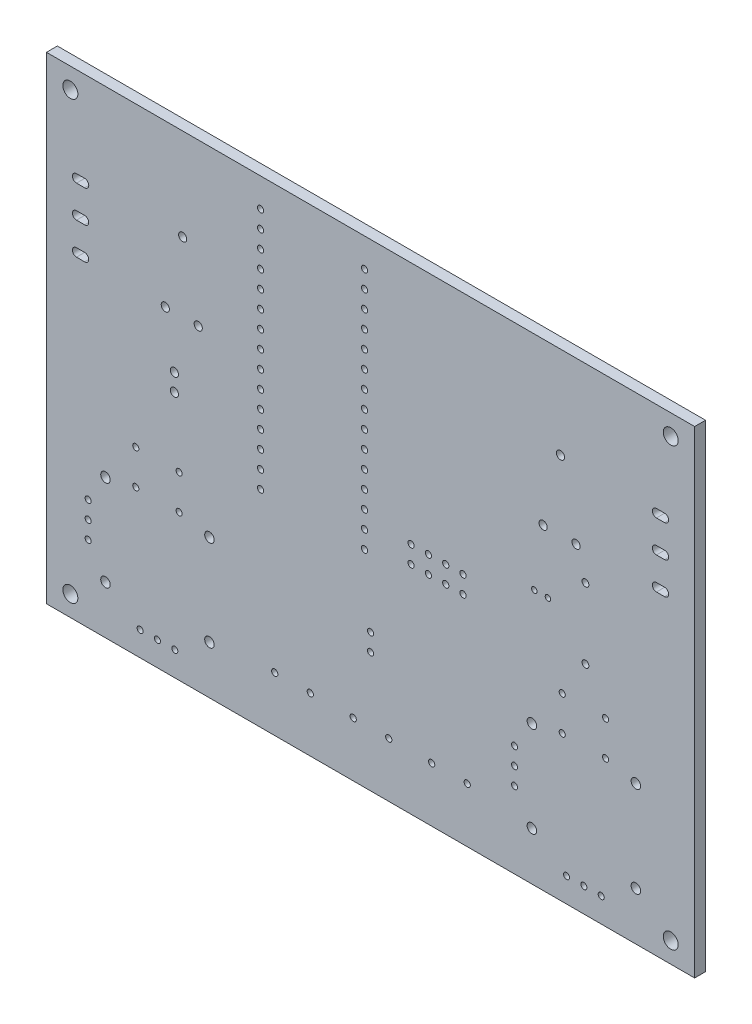
from build123d import *

# Parameters (mm, degrees)
SKETCH1_W           = 95.0000132
SKETCH1_H           = 70.0000124
SKETCH1_R           = 1.0999978
SKETCH1_R_2         = 0.6985
SKETCH1_R_3         = 0.4445
SKETCH1_R_4         = 0.4572
SKETCH1_R_5         = 0.44958
SKETCH1_R_6         = 0.4500118
SKETCH1_R_7         = 0.499999
SKETCH1_R_8         = 0.5999988
SKETCH1_R_9         = 0.3999992
BOSS_EXTRUDE1_DEPTH = 0.8


with BuildPart() as part:
    # Sketch1 → Boss-Extrude1 (new, symmetric)
    with BuildSketch(Plane.XY):
        with Locations((47.5000066, 35.0000062)):
            Rectangle(SKETCH1_W, SKETCH1_H)
        with Locations((3.50012, 2.9999686)):
            Circle(SKETCH1_R, mode=Mode.SUBTRACT)
        with Locations((91.499944, 2.9999686)):
            Circle(SKETCH1_R, mode=Mode.SUBTRACT)
        with Locations((3.50012, 66.9998406)):
            Circle(SKETCH1_R, mode=Mode.SUBTRACT)
        with Locations((91.499944, 66.9998406)):
            Circle(SKETCH1_R, mode=Mode.SUBTRACT)
        with Locations((8.6500208, 7.0752208)):
            Circle(SKETCH1_R_2, mode=Mode.SUBTRACT)
        with Locations((13.7300208, 3.5700208)):
            Circle(SKETCH1_R_3, mode=Mode.SUBTRACT)
        with Locations((16.2700208, 3.5700208)):
            Circle(SKETCH1_R_3, mode=Mode.SUBTRACT)
        with Locations((18.8100208, 3.5700208)):
            Circle(SKETCH1_R_3, mode=Mode.SUBTRACT)
        with Locations((6.1100208, 11.1900208)):
            Circle(SKETCH1_R_3, mode=Mode.SUBTRACT)
        with Locations((6.1100208, 13.7300208)):
            Circle(SKETCH1_R_3, mode=Mode.SUBTRACT)
        with Locations((6.1100208, 16.2700208)):
            Circle(SKETCH1_R_3, mode=Mode.SUBTRACT)
        with Locations((23.8900208, 7.0752208)):
            Circle(SKETCH1_R_2, mode=Mode.SUBTRACT)
        with Locations((33.4600042, 8.0000094)):
            Circle(SKETCH1_R_4, mode=Mode.SUBTRACT)
        with Locations((38.6670042, 8.0000094)):
            Circle(SKETCH1_R_4, mode=Mode.SUBTRACT)
        with Locations((44.9599558, 8.0000094)):
            Circle(SKETCH1_R_4, mode=Mode.SUBTRACT)
        with Locations((8.6500208, 20.3848208)):
            Circle(SKETCH1_R_2, mode=Mode.SUBTRACT)
        with Locations((13.0950208, 21.3500208)):
            Circle(SKETCH1_R_5, mode=Mode.SUBTRACT)
        with Locations((19.4450208, 21.3500208)):
            Circle(SKETCH1_R_5, mode=Mode.SUBTRACT)
        with Locations((13.0950208, 26.4300208)):
            Circle(SKETCH1_R_5, mode=Mode.SUBTRACT)
        with Locations((19.4450208, 26.4300208)):
            Circle(SKETCH1_R_5, mode=Mode.SUBTRACT)
        with Locations((23.8900208, 20.3848208)):
            Circle(SKETCH1_R_2, mode=Mode.SUBTRACT)
        with Locations((47.4980254, 17.602962)):
            Circle(SKETCH1_R_6, mode=Mode.SUBTRACT)
        with Locations((47.4980254, 20.142962)):
            Circle(SKETCH1_R_6, mode=Mode.SUBTRACT)
        with Locations((31.3800236, 30.2200056)):
            Circle(SKETCH1_R_4, mode=Mode.SUBTRACT)
        with Locations((31.3800236, 32.7600056)):
            Circle(SKETCH1_R_4, mode=Mode.SUBTRACT)
        with Locations((46.6200236, 30.2200056)):
            Circle(SKETCH1_R_4, mode=Mode.SUBTRACT)
        with Locations((46.6200236, 32.7600056)):
            Circle(SKETCH1_R_4, mode=Mode.SUBTRACT)
        with Locations((50.1669558, 8.0000094)):
            Circle(SKETCH1_R_4, mode=Mode.SUBTRACT)
        with Locations((56.460009, 8.0000094)):
            Circle(SKETCH1_R_4, mode=Mode.SUBTRACT)
        with Locations((61.667009, 8.0000094)):
            Circle(SKETCH1_R_4, mode=Mode.SUBTRACT)
        with Locations((71.1500228, 7.0752208)):
            Circle(SKETCH1_R_2, mode=Mode.SUBTRACT)
        with Locations((68.6100228, 11.1900208)):
            Circle(SKETCH1_R_3, mode=Mode.SUBTRACT)
        with Locations((68.6100228, 13.7300208)):
            Circle(SKETCH1_R_3, mode=Mode.SUBTRACT)
        with Locations((68.6100228, 16.2700208)):
            Circle(SKETCH1_R_3, mode=Mode.SUBTRACT)
        with Locations((76.2300228, 3.5700208)):
            Circle(SKETCH1_R_3, mode=Mode.SUBTRACT)
        with Locations((78.7700228, 3.5700208)):
            Circle(SKETCH1_R_3, mode=Mode.SUBTRACT)
        with Locations((81.3100228, 3.5700208)):
            Circle(SKETCH1_R_3, mode=Mode.SUBTRACT)
        with Locations((86.3900228, 7.0752208)):
            Circle(SKETCH1_R_2, mode=Mode.SUBTRACT)
        with Locations((71.1500228, 20.3848208)):
            Circle(SKETCH1_R_2, mode=Mode.SUBTRACT)
        with Locations((53.4399998, 31.7300102)):
            Circle(SKETCH1_R_4, mode=Mode.SUBTRACT)
        with Locations((55.9799998, 31.7300102)):
            Circle(SKETCH1_R_4, mode=Mode.SUBTRACT)
        with Locations((58.5199998, 31.7300102)):
            Circle(SKETCH1_R_4, mode=Mode.SUBTRACT)
        with Locations((53.4399998, 34.2700102)):
            Circle(SKETCH1_R_4, mode=Mode.SUBTRACT)
        with Locations((55.9799998, 34.2700102)):
            Circle(SKETCH1_R_4, mode=Mode.SUBTRACT)
        with Locations((58.5199998, 34.2700102)):
            Circle(SKETCH1_R_4, mode=Mode.SUBTRACT)
        with Locations((61.0599998, 31.7300102)):
            Circle(SKETCH1_R_4, mode=Mode.SUBTRACT)
        with Locations((61.0599998, 34.2700102)):
            Circle(SKETCH1_R_4, mode=Mode.SUBTRACT)
        with Locations((75.5950228, 21.3500208)):
            Circle(SKETCH1_R_5, mode=Mode.SUBTRACT)
        with Locations((81.9450228, 21.3500208)):
            Circle(SKETCH1_R_5, mode=Mode.SUBTRACT)
        with Locations((86.3900228, 20.3848208)):
            Circle(SKETCH1_R_2, mode=Mode.SUBTRACT)
        with Locations((75.5950228, 26.4300208)):
            Circle(SKETCH1_R_5, mode=Mode.SUBTRACT)
        with Locations((81.9450228, 26.4300208)):
            Circle(SKETCH1_R_5, mode=Mode.SUBTRACT)
        with Locations((79.00035, 31.8504062)):
            Circle(SKETCH1_R_7, mode=Mode.SUBTRACT)
        with Locations((18.7500006, 36.2300012)):
            Circle(SKETCH1_R_8, mode=Mode.SUBTRACT)
        with Locations((18.7500006, 38.7700012)):
            Circle(SKETCH1_R_8, mode=Mode.SUBTRACT)
        with BuildLine():
            Line((4.4000166, 47.4000068), (5.6000142, 47.4000068))
            ThreePointArc((5.6000142, 47.4000068), (6.200013, 46.800008), (5.6000142, 46.2000092))
            Line((5.6000142, 46.2000092), (4.4000166, 46.2000092))
            ThreePointArc((4.4000166, 46.2000092), (3.8000178, 46.800008), (4.4000166, 47.4000068))
        make_face(mode=Mode.SUBTRACT)
        with BuildLine():
            Line((4.4000166, 52.0999974), (5.6000142, 52.0999974))
            ThreePointArc((5.6000142, 52.0999974), (6.200013, 51.4999986), (5.6000142, 50.8999998))
            Line((5.6000142, 50.8999998), (4.4000166, 50.8999998))
            ThreePointArc((4.4000166, 50.8999998), (3.8000178, 51.4999986), (4.4000166, 52.0999974))
        make_face(mode=Mode.SUBTRACT)
        with Locations((17.4200058, 46.3799936)):
            Circle(SKETCH1_R_8, mode=Mode.SUBTRACT)
        with Locations((22.2460058, 46.3799936)):
            Circle(SKETCH1_R_8, mode=Mode.SUBTRACT)
        with Locations((31.3800236, 35.3000056)):
            Circle(SKETCH1_R_4, mode=Mode.SUBTRACT)
        with Locations((31.3800236, 37.8400056)):
            Circle(SKETCH1_R_4, mode=Mode.SUBTRACT)
        with Locations((31.3800236, 40.3800056)):
            Circle(SKETCH1_R_4, mode=Mode.SUBTRACT)
        with Locations((31.3800236, 42.9200056)):
            Circle(SKETCH1_R_4, mode=Mode.SUBTRACT)
        with Locations((46.6200236, 35.3000056)):
            Circle(SKETCH1_R_4, mode=Mode.SUBTRACT)
        with Locations((46.6200236, 37.8400056)):
            Circle(SKETCH1_R_4, mode=Mode.SUBTRACT)
        with Locations((46.6200236, 40.3800056)):
            Circle(SKETCH1_R_4, mode=Mode.SUBTRACT)
        with Locations((46.6200236, 42.9200056)):
            Circle(SKETCH1_R_4, mode=Mode.SUBTRACT)
        with Locations((31.3800236, 45.4600056)):
            Circle(SKETCH1_R_4, mode=Mode.SUBTRACT)
        with Locations((31.3800236, 48.0000056)):
            Circle(SKETCH1_R_4, mode=Mode.SUBTRACT)
        with Locations((31.3800236, 50.5400056)):
            Circle(SKETCH1_R_4, mode=Mode.SUBTRACT)
        with Locations((46.6200236, 45.4600056)):
            Circle(SKETCH1_R_4, mode=Mode.SUBTRACT)
        with Locations((46.6200236, 48.0000056)):
            Circle(SKETCH1_R_4, mode=Mode.SUBTRACT)
        with Locations((46.6200236, 50.5400056)):
            Circle(SKETCH1_R_4, mode=Mode.SUBTRACT)
        with BuildLine():
            Line((4.4000166, 56.799988), (5.6000142, 56.799988))
            ThreePointArc((5.6000142, 56.799988), (6.200013, 56.1999892), (5.6000142, 55.5999904))
            Line((5.6000142, 55.5999904), (4.4000166, 55.5999904))
            ThreePointArc((4.4000166, 55.5999904), (3.8000178, 56.1999892), (4.4000166, 56.799988))
        make_face(mode=Mode.SUBTRACT)
        with Locations((19.9600058, 56.5399936)):
            Circle(SKETCH1_R_8, mode=Mode.SUBTRACT)
        with Locations((31.3800236, 53.0800056)):
            Circle(SKETCH1_R_4, mode=Mode.SUBTRACT)
        with Locations((31.3800236, 55.6200056)):
            Circle(SKETCH1_R_4, mode=Mode.SUBTRACT)
        with Locations((31.3800236, 58.1600056)):
            Circle(SKETCH1_R_4, mode=Mode.SUBTRACT)
        with Locations((31.3800236, 60.7000056)):
            Circle(SKETCH1_R_4, mode=Mode.SUBTRACT)
        with Locations((46.6200236, 53.0800056)):
            Circle(SKETCH1_R_4, mode=Mode.SUBTRACT)
        with Locations((46.6200236, 55.6200056)):
            Circle(SKETCH1_R_4, mode=Mode.SUBTRACT)
        with Locations((46.6200236, 58.1600056)):
            Circle(SKETCH1_R_4, mode=Mode.SUBTRACT)
        with Locations((46.6200236, 60.7000056)):
            Circle(SKETCH1_R_4, mode=Mode.SUBTRACT)
        with Locations((31.3800236, 63.2400056)):
            Circle(SKETCH1_R_4, mode=Mode.SUBTRACT)
        with Locations((31.3800236, 65.7800056)):
            Circle(SKETCH1_R_4, mode=Mode.SUBTRACT)
        with Locations((46.6200236, 63.2400056)):
            Circle(SKETCH1_R_4, mode=Mode.SUBTRACT)
        with Locations((46.6200236, 65.7800056)):
            Circle(SKETCH1_R_4, mode=Mode.SUBTRACT)
        with Locations((71.5000094, 37.5000012)):
            Circle(SKETCH1_R_9, mode=Mode.SUBTRACT)
        with Locations((73.5000054, 37.5000012)):
            Circle(SKETCH1_R_9, mode=Mode.SUBTRACT)
        with Locations((79.00035, 42.150411)):
            Circle(SKETCH1_R_7, mode=Mode.SUBTRACT)
        with Locations((72.795003, 46.3799936)):
            Circle(SKETCH1_R_8, mode=Mode.SUBTRACT)
        with Locations((77.621003, 46.3799936)):
            Circle(SKETCH1_R_8, mode=Mode.SUBTRACT)
        with BuildLine():
            Line((89.4000244, 47.4000068), (90.600022, 47.4000068))
            ThreePointArc((90.600022, 47.4000068), (91.2000208, 46.800008), (90.600022, 46.2000092))
            Line((90.600022, 46.2000092), (89.4000244, 46.2000092))
            ThreePointArc((89.4000244, 46.2000092), (88.8000256, 46.800008), (89.4000244, 47.4000068))
        make_face(mode=Mode.SUBTRACT)
        with BuildLine():
            Line((89.4000244, 52.0999974), (90.600022, 52.0999974))
            ThreePointArc((90.600022, 52.0999974), (91.2000208, 51.4999986), (90.600022, 50.8999998))
            Line((90.600022, 50.8999998), (89.4000244, 50.8999998))
            ThreePointArc((89.4000244, 50.8999998), (88.8000256, 51.4999986), (89.4000244, 52.0999974))
        make_face(mode=Mode.SUBTRACT)
        with Locations((75.335003, 56.5399936)):
            Circle(SKETCH1_R_8, mode=Mode.SUBTRACT)
        with BuildLine():
            Line((89.4000244, 56.799988), (90.600022, 56.799988))
            ThreePointArc((90.600022, 56.799988), (91.2000208, 56.1999892), (90.600022, 55.5999904))
            Line((90.600022, 55.5999904), (89.4000244, 55.5999904))
            ThreePointArc((89.4000244, 55.5999904), (88.8000256, 56.1999892), (89.4000244, 56.799988))
        make_face(mode=Mode.SUBTRACT)
    extrude(amount=BOSS_EXTRUDE1_DEPTH, both=True)


solid = part.part
